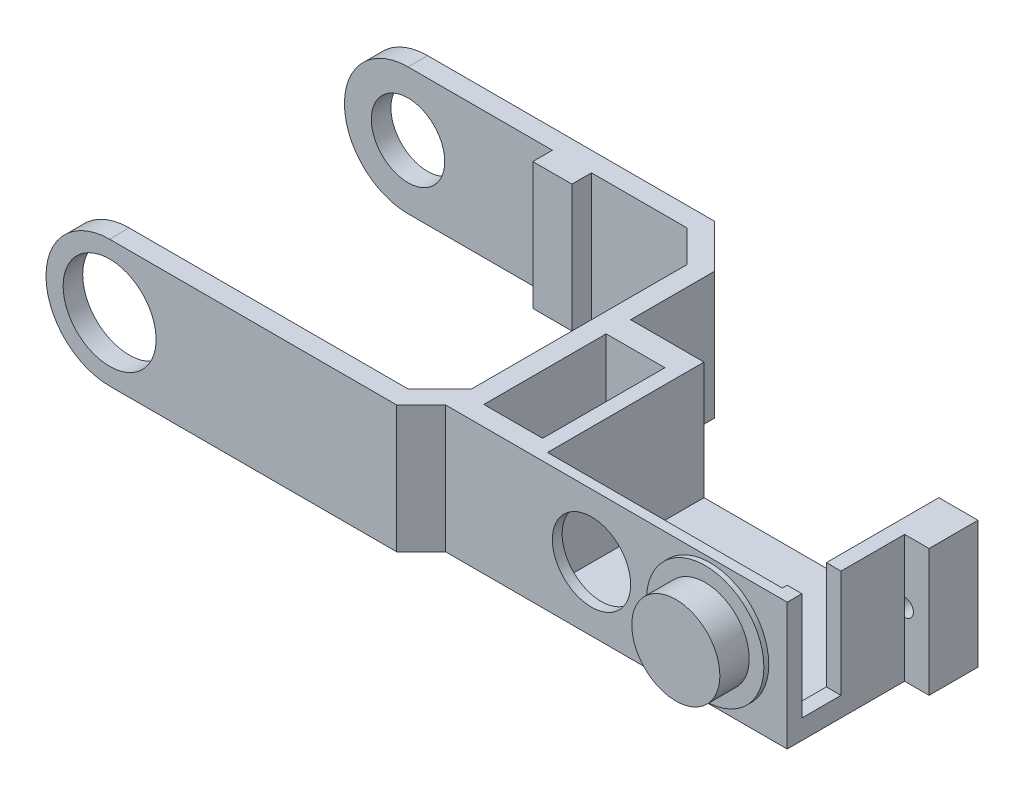
from build123d import *

# Parameters (mm, degrees)
P_IDAT_VYSUNUT_M1_DEPTH  = 13
P_IDAT_VYSUNUT_M2_DEPTH  = 13
SKICA3_W                 = 6
SKICA3_H                 = 12.5
ODEBRAT_VYSUNUT_M1_DEPTH = 44.544517451
SKICA4_W                 = 24
SKICA4_H                 = 16
ODEBRAT_VYSUNUT_M2_DEPTH = 12
SKICA5_R                 = 0.9
ODEBRAT_VYSUNUT_M3_DEPTH = 5
ZAOBLIT1_R               = 6.5
SKICA6_R                 = 3.75
ODEBRAT_VYSUNUT_M4_DEPTH = 5
SKICA7_R                 = 4.75
ODEBRAT_VYSUNUT_M5_DEPTH = 5
SKICA8_W                 = 4
SKICA8_H                 = 11
ODEBRAT_VYSUNUT_M6_DEPTH = 5
SKICA9_R                 = 4
ODEBRAT_VYSUNUT_M7_DEPTH = 10
SKICA10_R                = 6
P_IDAT_VYSUNUT_M3_DEPTH  = 0.5
SKICA11_R                = 4.5
P_IDAT_VYSUNUT_M4_DEPTH  = 3
SKICA12_W                = 4
SKICA12_H                = 2
P_IDAT_VYSUNUT_M5_DEPTH  = 13


with BuildPart() as part:
    # Skica1 → Přidat vysunutím1 (new body)
    with BuildSketch(Plane(origin=(0, 0, 0), x_dir=(1, 0, 0), z_dir=(0, 1, 0))):
        Polygon((0, -11), (0, 11), (-3.25, 14.25), (-38.25, 14.25), (-38.25, 16.25), (-2.421572875, 16.25), (2, 11.828427125), (2, -11.828427125), (-2.421572875, -16.25), (-38.25, -16.25), (-38.25, -14.25), (-3.25, -14.25), align=None)
    extrude(amount=P_IDAT_VYSUNUT_M1_DEPTH)

    # Skica2 → Přidat vysunutím2 (add)
    with BuildSketch(Plane.XZ):
        Polygon((0.078427125, 13.75), (35, 13.75), (35, 1.75), (37.5, 1.75), (37.5, -3.25), (2, -3.25), (2, 11.828427125), align=None)
    extrude(amount=-P_IDAT_VYSUNUT_M2_DEPTH)

    # Skica3 → Odebrat vysunutím1 (cut, through all)
    with BuildSketch(Plane(origin=(0, 13, 0), x_dir=(1, 0, 0), z_dir=(0, 1, 0))):
        with Locations((5, -5.5)):
            Rectangle(SKICA3_W, SKICA3_H)
    extrude(amount=-ODEBRAT_VYSUNUT_M1_DEPTH, mode=Mode.SUBTRACT)

    # Skica4 → Odebrat vysunutím2 (cut)
    with BuildSketch(Plane(origin=(0, 13, 0), x_dir=(1, 0, 0), z_dir=(0, 1, 0))):
        with Locations((21.5, -4.75)):
            Rectangle(SKICA4_W, SKICA4_H)
    extrude(amount=-ODEBRAT_VYSUNUT_M2_DEPTH, mode=Mode.SUBTRACT)

    # Skica5 → Odebrat vysunutím3 (cut)
    with BuildSketch(Plane(origin=(0, 0, -3.25), x_dir=(-1, 0, 0), z_dir=(0, 0, -1))):
        with Locations((-34.993787626, 6.555058734)):
            Circle(SKICA5_R)
        with Locations((-8.006314188, 6.5550616)):
            Circle(SKICA5_R)
    extrude(amount=-ODEBRAT_VYSUNUT_M3_DEPTH, mode=Mode.SUBTRACT)

    # Zaoblit1
    zaoblit1_edges = [part.edges().sort_by_distance(p)[0] for p in [
        (-38.25, 0, -15.25),
        (-38.25, 0, 15.25),
        (-38.25, 13, 15.25),
        (-38.25, 13, -15.25),
    ]]
    fillet(zaoblit1_edges, radius=ZAOBLIT1_R - 0.0001)  # a hair under: the kernel refuses the full size

    # Skica6 → Odebrat vysunutím4 (cut)
    with BuildSketch(Plane(origin=(0, 0, -16.25), x_dir=(-1, 0, 0), z_dir=(0, 0, -1))):
        with Locations((31.75, 6.5)):
            Circle(SKICA6_R)
    extrude(amount=-ODEBRAT_VYSUNUT_M4_DEPTH, mode=Mode.SUBTRACT)

    # Skica7 → Odebrat vysunutím5 (cut)
    with BuildSketch(Plane(origin=(0, 0, 14.25), x_dir=(-1, 0, 0), z_dir=(0, 0, -1))):
        with Locations((31.75, 6.5)):
            Circle(SKICA7_R)
    extrude(amount=-ODEBRAT_VYSUNUT_M5_DEPTH, mode=Mode.SUBTRACT)

    # Skica8 → Odebrat vysunutím6 (cut)
    with BuildSketch(Plane(origin=(35, 0, 0), x_dir=(0, 0, -1), z_dir=(1, 0, 0))):
        with Locations((-10.25, 7.5)):
            Rectangle(SKICA8_W, SKICA8_H)
    extrude(amount=-ODEBRAT_VYSUNUT_M6_DEPTH, mode=Mode.SUBTRACT)

    # Skica9 → Odebrat vysunutím7 (cut)
    with BuildSketch(Plane.XY.offset(13.75)):
        with Locations((15, 6.554999832)):
            Circle(SKICA9_R)
    extrude(amount=-ODEBRAT_VYSUNUT_M7_DEPTH, mode=Mode.SUBTRACT)

    # Skica10 → Přidat vysunutím3 (add)
    with BuildSketch(Plane.XY.offset(13.75)):
        with Locations((27.118831388, 6.554999832)):
            Circle(SKICA10_R)
    extrude(amount=P_IDAT_VYSUNUT_M3_DEPTH)

    # Skica11 → Přidat vysunutím4 (add)
    with BuildSketch(Plane.XY.offset(14.25)):
        with Locations((27.118831388, 6.554999832)):
            Circle(SKICA11_R)
    extrude(amount=P_IDAT_VYSUNUT_M4_DEPTH)

    # Skica12 → Přidat vysunutím5 (add)
    with BuildSketch(Plane(origin=(0, 13, 0), x_dir=(1, 0, 0), z_dir=(0, 1, 0))):
        with Locations((-15, 13.25)):
            Rectangle(SKICA12_W, SKICA12_H)
    extrude(amount=-P_IDAT_VYSUNUT_M5_DEPTH)


solid = part.part
